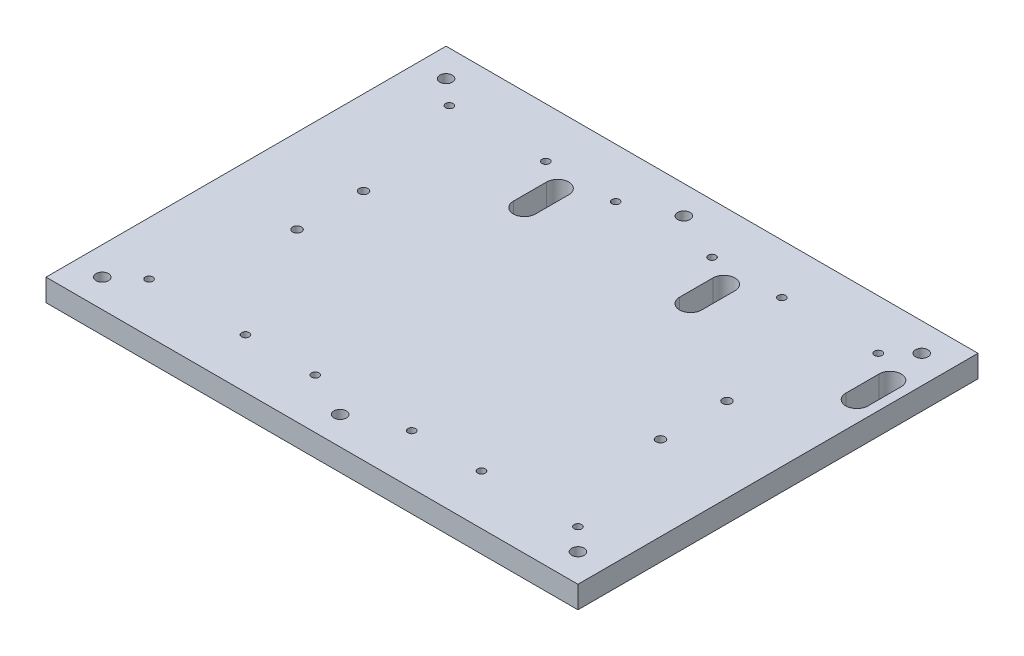
from build123d import *

# Parameters (mm, degrees)
SKETCH1_W           = 240
SKETCH1_H           = 180.5
BOSS_EXTRUDE1_DEPTH = 10
SKETCH1_5_R         = 1.7
CUT_EXTRUDE2_DEPTH  = 151.482764794
SKETCH2_W           = 140
SKETCH2_H           = 6
BOSS_EXTRUDE3_DEPTH = 30
SKETCH3_W           = 140
SKETCH3_H           = 10
BOSS_EXTRUDE4_DEPTH = 20
SKETCH4_R           = 2
CUT_EXTRUDE4_DEPTH  = 154.117805953
SKETCH7_R           = 2.8
CUT_EXTRUDE5_DEPTH  = 154.117805953
CUT_EXTRUDE6_DEPTH  = 156.386815721


with BuildPart() as part:
    # Sketch1 → Boss-Extrude1 (new body)
    with BuildSketch(Plane(origin=(0, 0, 0), x_dir=(1, 0, 0), z_dir=(0, 1, 0))):
        Rectangle(SKETCH1_W, SKETCH1_H)
    extrude(amount=-BOSS_EXTRUDE1_DEPTH)

    # Sketch1<5> → Cut-Extrude2 (cut, through all)
    with BuildSketch(Plane(origin=(0, 0, 0), x_dir=(1, 0, 0), z_dir=(0, 1, 0))):
        with Locations((-96, 67.75)):
            Circle(SKETCH1_5_R)
        with Locations((-96, -67.75)):
            Circle(SKETCH1_5_R)
        with Locations((-52.5, -67.75)):
            Circle(SKETCH1_5_R)
        with Locations((-52.5, 67.75)):
            Circle(SKETCH1_5_R)
        with Locations((-21, 67.75)):
            Circle(SKETCH1_5_R)
        with Locations((-21, -67.75)):
            Circle(SKETCH1_5_R)
        with Locations((22.5, -67.75)):
            Circle(SKETCH1_5_R)
        with Locations((22.5, 67.75)):
            Circle(SKETCH1_5_R)
        with Locations((54, 67.75)):
            Circle(SKETCH1_5_R)
        with Locations((54, -67.75)):
            Circle(SKETCH1_5_R)
        with Locations((97.5, -67.75)):
            Circle(SKETCH1_5_R)
        with Locations((97.5, 67.75)):
            Circle(SKETCH1_5_R)
    extrude(amount=-CUT_EXTRUDE2_DEPTH, mode=Mode.SUBTRACT)

    # Sketch2 → Boss-Extrude3 (add)
    with BuildSketch(Plane.XZ.offset(10)):
        Rectangle(SKETCH2_W, SKETCH2_H)
    extrude(amount=BOSS_EXTRUDE3_DEPTH)

    # Sketch3 → Boss-Extrude4 (add)
    with BuildSketch(Plane.XZ.offset(10)):
        Rectangle(SKETCH3_W, SKETCH3_H)
    extrude(amount=BOSS_EXTRUDE4_DEPTH)

    # Sketch4 → Cut-Extrude4 (cut, through all)
    with BuildSketch(Plane.XZ.offset(10)):
        with Locations((-82, 15)):
            Circle(SKETCH4_R)
        with Locations((82, 15)):
            Circle(SKETCH4_R)
        with Locations((82, -15)):
            Circle(SKETCH4_R)
        with Locations((-82, -15)):
            Circle(SKETCH4_R)
    extrude(amount=-CUT_EXTRUDE4_DEPTH, mode=Mode.SUBTRACT)

    # Sketch7 → Cut-Extrude5 (cut, through all)
    with BuildSketch(Plane.XZ.offset(10)):
        with Locations((-107.3, 77.55)):
            Circle(SKETCH7_R)
        with Locations((0, 77.55)):
            Circle(SKETCH7_R)
        with Locations((107.3, 77.55)):
            Circle(SKETCH7_R)
        with Locations((-107.3, -77.55)):
            Circle(SKETCH7_R)
        with Locations((0, -77.55)):
            Circle(SKETCH7_R)
        with Locations((107.3, -77.55)):
            Circle(SKETCH7_R)
    extrude(amount=-CUT_EXTRUDE5_DEPTH, mode=Mode.SUBTRACT)

    # Sketch9 → Cut-Extrude6 (cut, through all)
    with BuildSketch(Plane(origin=(0, 0, 0), x_dir=(1, 0, 0), z_dir=(0, 1, 0))):
        with BuildLine():
            Line((-34.25, 59.85), (-34.25, 44.85))
            ThreePointArc((-34.25, 44.85), (-39.25, 39.85), (-44.25, 44.85))
            Line((-44.25, 44.85), (-44.25, 59.85))
            ThreePointArc((-44.25, 59.85), (-39.25, 64.85), (-34.25, 59.85))
        make_face()
        with BuildLine():
            Line((40.75, 59.85), (40.75, 44.85))
            ThreePointArc((40.75, 44.85), (35.75, 39.85), (30.75, 44.85))
            Line((30.75, 44.85), (30.75, 59.85))
            ThreePointArc((30.75, 59.85), (35.75, 64.85), (40.75, 59.85))
        make_face()
        with BuildLine():
            Line((115.75, 59.85), (115.75, 44.85))
            ThreePointArc((115.75, 44.85), (110.75, 39.85), (105.75, 44.85))
            Line((105.75, 44.85), (105.75, 59.85))
            ThreePointArc((105.75, 59.85), (110.75, 64.85), (115.75, 59.85))
        make_face()
    extrude(amount=-CUT_EXTRUDE6_DEPTH, mode=Mode.SUBTRACT)


solid = part.part
